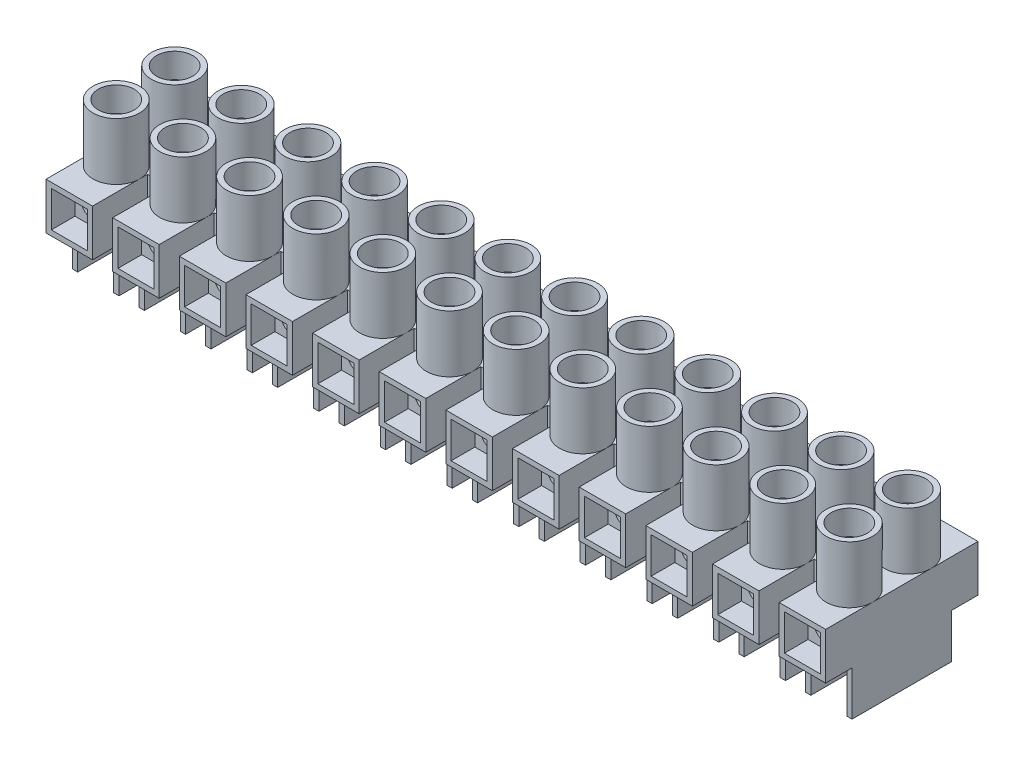
from build123d import *

# Parameters (mm, degrees)
SKETCH1_W           = 5.588
SKETCH1_H           = 5.588
BOSS_EXTRUDE1_DEPTH = 9.144
SKETCH2_R           = 2.794
BOSS_EXTRUDE2_DEPTH = 6.858
SHELL1_START        = 0.635
SHELL1_OUTLINE_R    = 2.159
SHELL1_DEPTH        = 11.811
SHELL1_2_DEPTH      = 4.318
SKETCH3_W           = 5.588
SKETCH3_H           = 5.969
BOSS_EXTRUDE3_DEPTH = 5.334
SHELL2_START        = -5.334
SHELL2_OUTLINE_W    = 4.318
SHELL2_OUTLINE_H    = 5.969
SHELL2_DEPTH        = 5.334
LPATTERN1_COUNT     = 12
LPATTERN1_PITCH     = 8.001
SKETCH5_W           = 2.413
SKETCH5_H           = 2.54
BOSS_EXTRUDE4_DEPTH = 5.588
CUT_EXTRUDE1_START  = -95.864579549
SKETCH7_R           = 1.4986
CUT_EXTRUDE1_DEPTH  = 101.452579549
LPATTERN2_COUNT     = 11
LPATTERN2_PITCH     = 8.001
LPATTERN2_2_COUNT   = 11
LPATTERN2_2_PITCH   = 8.001
SKETCH8_W           = 4.2164
SKETCH8_H           = 4.2164
SKETCH8_R           = 1.397
BOSS_EXTRUDE5_DEPTH = 6.35
LPATTERN3_COUNT     = 12
LPATTERN3_PITCH     = 8.001
SKETCH9_R           = 1.5875
BOSS_EXTRUDE6_DEPTH = 1.524
BOSS_EXTRUDE6_DRAFT = -15
SKETCH10_W          = 3.991709138
SKETCH10_H          = 0.508
CUT_EXTRUDE2_DEPTH  = 0.508
SKETCH11_R          = 1.143
BOSS_EXTRUDE7_DEPTH = 3.81
LPATTERN4_COUNT     = 12
LPATTERN4_PITCH     = 8.001
LPATTERN4_2_COUNT   = 2
LPATTERN4_2_PITCH   = 7.0104


# Read off the part's stored shape, not the designer's step: Shell1, Shell2
with BuildPart() as part:
    # Sketch1 → Boss-Extrude1 (new body)
    with BuildSketch(Plane.XY):
        with Locations((2.794, 2.794)):
            Rectangle(SKETCH1_W, SKETCH1_H)
    extrude(amount=BOSS_EXTRUDE1_DEPTH)

    # Sketch2 → Boss-Extrude2 (add)
    with BuildSketch(Plane(origin=(0, 5.588, 0), x_dir=(1, 0, 0), z_dir=(0, 1, 0))):
        with Locations(Location((2.794, -3.5052, 0), (0, 0, 180))):
            Circle(SKETCH2_R)
    extrude(amount=BOSS_EXTRUDE2_DEPTH)

    # Shell1 outline → Shell1 (cut)
    with BuildSketch(Plane(origin=(0, 0, 0), x_dir=(1, 0, 0), z_dir=(0, 1, 0)).offset(SHELL1_START)):
        with Locations((2.794, -3.5052)):
            Circle(SHELL1_OUTLINE_R)
    extrude(amount=SHELL1_DEPTH, mode=Mode.SUBTRACT)

    # Shell1 2 outline → Shell1 2 (cut)
    with BuildSketch(Plane(origin=(0, 0, 0), x_dir=(1, 0, 0), z_dir=(0, 1, 0)).offset(SHELL1_START)):
        with BuildLine():
            Line((0.635, -3.5052), (0.635, -9.144))
            Line((0.635, -9.144), (4.953, -9.144))
            Line((4.953, -9.144), (4.953, -3.5052))
            ThreePointArc((4.953, -3.5052), (2.794, -5.6642), (0.635, -3.5052))
        make_face()
        with BuildLine():
            Line((0.635, 0), (0.635, -3.5052))
            ThreePointArc((0.635, -3.5052), (2.794, -1.3462), (4.953, -3.5052))
            Line((4.953, -3.5052), (4.953, 0))
            Line((4.953, 0), (0.635, 0))
        make_face()
    extrude(amount=SHELL1_2_DEPTH, mode=Mode.SUBTRACT)

    # Sketch3 → Boss-Extrude3 (add)
    with BuildSketch(Plane.XZ):
        with Locations((2.794, 2.9845)):
            Rectangle(SKETCH3_W, SKETCH3_H)
    extrude(amount=BOSS_EXTRUDE3_DEPTH)

    # Shell2 outline → Shell2 (cut)
    with BuildSketch(Plane(origin=(0, 0, 0), x_dir=(1, 0, 0), z_dir=(0, 1, 0)).offset(SHELL2_START)):
        with Locations((2.794, -2.9845)):
            Rectangle(SHELL2_OUTLINE_W, SHELL2_OUTLINE_H)
    extrude(amount=SHELL2_DEPTH, mode=Mode.SUBTRACT)


with BuildPart() as lpattern1_1:
    # LPattern1: pattern copy
    add(part.part.moved(Location(Vector(1, 0, 0) * (1 * LPATTERN1_PITCH))))


with BuildPart() as lpattern1_2:
    # LPattern1: pattern copy
    add(part.part.moved(Location(Vector(1, 0, 0) * (2 * LPATTERN1_PITCH))))


with BuildPart() as lpattern1_3:
    # LPattern1: pattern copy
    add(part.part.moved(Location(Vector(1, 0, 0) * (3 * LPATTERN1_PITCH))))


with BuildPart() as lpattern1_4:
    # LPattern1: pattern copy
    add(part.part.moved(Location(Vector(1, 0, 0) * (4 * LPATTERN1_PITCH))))


with BuildPart() as lpattern1_5:
    # LPattern1: pattern copy
    add(part.part.moved(Location(Vector(1, 0, 0) * (5 * LPATTERN1_PITCH))))


with BuildPart() as lpattern1_6:
    # LPattern1: pattern copy
    add(part.part.moved(Location(Vector(1, 0, 0) * (6 * LPATTERN1_PITCH))))


with BuildPart() as lpattern1_7:
    # LPattern1: pattern copy
    add(part.part.moved(Location(Vector(1, 0, 0) * (7 * LPATTERN1_PITCH))))


with BuildPart() as lpattern1_8:
    # LPattern1: pattern copy
    add(part.part.moved(Location(Vector(1, 0, 0) * (8 * LPATTERN1_PITCH))))


with BuildPart() as lpattern1_9:
    # LPattern1: pattern copy
    add(part.part.moved(Location(Vector(1, 0, 0) * (9 * LPATTERN1_PITCH))))


with BuildPart() as lpattern1_10:
    # LPattern1: pattern copy
    add(part.part.moved(Location(Vector(1, 0, 0) * (10 * LPATTERN1_PITCH))))


with BuildPart() as lpattern1_11:
    # LPattern1: pattern copy
    add(part.part.moved(Location(Vector(1, 0, 0) * (11 * LPATTERN1_PITCH))))


with BuildPart() as part_1:
    add(part.part)

    add(lpattern1_1.part)  # Boss-Extrude4 merges LPattern1_1
    # Sketch5 → Boss-Extrude4 (add)
    with BuildSketch(Plane(origin=(0, 0, 0), x_dir=(1, 0, 0), z_dir=(0, 1, 0))):
        with Locations((6.7945, -1.27)):
            Rectangle(SKETCH5_W, SKETCH5_H)
    boss_extrude4 = extrude(amount=BOSS_EXTRUDE4_DEPTH)

    # Sketch7 → Cut-Extrude1 (cut)
    with BuildSketch(Plane(origin=(0, 0, 0), x_dir=(1, 0, 0), z_dir=(0, 1, 0)).offset(CUT_EXTRUDE1_START)):
        with Locations((6.7945, 0)):
            Circle(SKETCH7_R)
    cut_extrude1 = extrude(amount=CUT_EXTRUDE1_DEPTH, mode=Mode.SUBTRACT)

    add(lpattern1_2.part)  # LPattern2 merges LPattern1_2

    add(lpattern1_3.part)  # LPattern2 merges LPattern1_3

    add(lpattern1_4.part)  # LPattern2 merges LPattern1_4

    add(lpattern1_5.part)  # LPattern2 merges LPattern1_5

    add(lpattern1_6.part)  # LPattern2 merges LPattern1_6

    add(lpattern1_7.part)  # LPattern2 merges LPattern1_7

    add(lpattern1_8.part)  # LPattern2 merges LPattern1_8

    add(lpattern1_9.part)  # LPattern2 merges LPattern1_9

    add(lpattern1_10.part)  # LPattern2 merges LPattern1_10

    add(lpattern1_11.part)  # LPattern2 merges LPattern1_11
    # LPattern2: Boss-Extrude4 ×11
    with Locations(*[(i * LPATTERN2_PITCH, 0, 0) for i in range(1, LPATTERN2_COUNT)]):
        add(boss_extrude4)

    # LPattern2 2: Cut-Extrude1 ×11
    with Locations(*[(i * LPATTERN2_2_PITCH, 0, 0) for i in range(1, LPATTERN2_2_COUNT)]):
        add(cut_extrude1, mode=Mode.SUBTRACT)

    # Mirror1: part across plane


with BuildPart() as part_2:
    add(part_1.part)
    add(part_1.part.mirror(Plane.XY))


with BuildPart() as body_2:
    # Sketch8 → Boss-Extrude5 (new body)
    with BuildSketch(Plane.XY):
        with Locations((2.794, 2.794)):
            Rectangle(SKETCH8_W, SKETCH8_H)
        with Locations((2.794, 2.794)):
            Circle(SKETCH8_R, mode=Mode.SUBTRACT)
    extrude(amount=BOSS_EXTRUDE5_DEPTH)

    # Mirror2: body 2 across plane


with BuildPart() as body_2_1:
    add(body_2.part)
    add(body_2.part.mirror(Plane.XY))


with BuildPart() as lpattern3_1:
    # LPattern3: pattern copy
    add(body_2_1.part.moved(Location(Vector(1, 0, 0) * (1 * LPATTERN3_PITCH))))


with BuildPart() as lpattern3_2:
    # LPattern3: pattern copy
    add(body_2_1.part.moved(Location(Vector(1, 0, 0) * (2 * LPATTERN3_PITCH))))


with BuildPart() as lpattern3_3:
    # LPattern3: pattern copy
    add(body_2_1.part.moved(Location(Vector(1, 0, 0) * (3 * LPATTERN3_PITCH))))


with BuildPart() as lpattern3_4:
    # LPattern3: pattern copy
    add(body_2_1.part.moved(Location(Vector(1, 0, 0) * (4 * LPATTERN3_PITCH))))


with BuildPart() as lpattern3_5:
    # LPattern3: pattern copy
    add(body_2_1.part.moved(Location(Vector(1, 0, 0) * (5 * LPATTERN3_PITCH))))


with BuildPart() as lpattern3_6:
    # LPattern3: pattern copy
    add(body_2_1.part.moved(Location(Vector(1, 0, 0) * (6 * LPATTERN3_PITCH))))


with BuildPart() as lpattern3_7:
    # LPattern3: pattern copy
    add(body_2_1.part.moved(Location(Vector(1, 0, 0) * (7 * LPATTERN3_PITCH))))


with BuildPart() as lpattern3_8:
    # LPattern3: pattern copy
    add(body_2_1.part.moved(Location(Vector(1, 0, 0) * (8 * LPATTERN3_PITCH))))


with BuildPart() as lpattern3_9:
    # LPattern3: pattern copy
    add(body_2_1.part.moved(Location(Vector(1, 0, 0) * (9 * LPATTERN3_PITCH))))


with BuildPart() as lpattern3_10:
    # LPattern3: pattern copy
    add(body_2_1.part.moved(Location(Vector(1, 0, 0) * (10 * LPATTERN3_PITCH))))


with BuildPart() as lpattern3_11:
    # LPattern3: pattern copy
    add(body_2_1.part.moved(Location(Vector(1, 0, 0) * (11 * LPATTERN3_PITCH))))


with BuildPart() as body_14:
    # Sketch9 → Boss-Extrude6 (with draft: the straight prism first)
    with BuildSketch(Plane(origin=(0, 8.0772, 0), x_dir=(1, 0, 0), z_dir=(0, 1, 0))):
        with Locations((2.794, -3.5052)):
            Circle(SKETCH9_R)
    extrude(amount=BOSS_EXTRUDE6_DEPTH)
    # Boss-Extrude6: the draft: its side faces are tilted about the plane it starts from
    boss_extrude6_sides = [body_14.faces().sort_by_distance(p)[0] for p in [
        (1.2065, 8.8392, 3.5052),
    ]]
    draft(boss_extrude6_sides, Plane(origin=(0, 8.0772, 0), x_dir=(1, 0, 0), z_dir=(0, 1, 0)), BOSS_EXTRUDE6_DRAFT)

    # Sketch10 → Cut-Extrude2 (cut)
    with BuildSketch(Plane(origin=(0, 9.6012, 0), x_dir=(1, 0, 0), z_dir=(0, 1, 0))):
        with Locations((2.794, -3.5052)):
            Rectangle(SKETCH10_W, SKETCH10_H)
    extrude(amount=-CUT_EXTRUDE2_DEPTH, mode=Mode.SUBTRACT)

    # Sketch11 → Boss-Extrude7 (add)
    with BuildSketch(Plane.XZ.offset(-8.0772)):
        with Locations(Location((2.794, 3.5052, 0), (0, 0, 90))):
            Circle(SKETCH11_R)
    extrude(amount=BOSS_EXTRUDE7_DEPTH)


with BuildPart() as lpattern4_1:
    # LPattern4: pattern copy
    add(body_14.part.moved(Location(Vector(1, 0, 0) * (1 * LPATTERN4_PITCH))))


with BuildPart() as lpattern4_2:
    # LPattern4: pattern copy
    add(body_14.part.moved(Location(Vector(1, 0, 0) * (2 * LPATTERN4_PITCH))))


with BuildPart() as lpattern4_3:
    # LPattern4: pattern copy
    add(body_14.part.moved(Location(Vector(1, 0, 0) * (3 * LPATTERN4_PITCH))))


with BuildPart() as lpattern4_4:
    # LPattern4: pattern copy
    add(body_14.part.moved(Location(Vector(1, 0, 0) * (4 * LPATTERN4_PITCH))))


with BuildPart() as lpattern4_5:
    # LPattern4: pattern copy
    add(body_14.part.moved(Location(Vector(1, 0, 0) * (5 * LPATTERN4_PITCH))))


with BuildPart() as lpattern4_6:
    # LPattern4: pattern copy
    add(body_14.part.moved(Location(Vector(1, 0, 0) * (6 * LPATTERN4_PITCH))))


with BuildPart() as lpattern4_7:
    # LPattern4: pattern copy
    add(body_14.part.moved(Location(Vector(1, 0, 0) * (7 * LPATTERN4_PITCH))))


with BuildPart() as lpattern4_8:
    # LPattern4: pattern copy
    add(body_14.part.moved(Location(Vector(1, 0, 0) * (8 * LPATTERN4_PITCH))))


with BuildPart() as lpattern4_9:
    # LPattern4: pattern copy
    add(body_14.part.moved(Location(Vector(1, 0, 0) * (9 * LPATTERN4_PITCH))))


with BuildPart() as lpattern4_10:
    # LPattern4: pattern copy
    add(body_14.part.moved(Location(Vector(1, 0, 0) * (10 * LPATTERN4_PITCH))))


with BuildPart() as lpattern4_11:
    # LPattern4: pattern copy
    add(body_14.part.moved(Location(Vector(1, 0, 0) * (11 * LPATTERN4_PITCH))))


with BuildPart() as lpattern4_2_1:
    # LPattern4 2: pattern copy
    add(body_14.part.moved(Location(Vector(0, 0, -1) * (1 * LPATTERN4_2_PITCH))))


with BuildPart() as lpattern4_2_2:
    # LPattern4 2: pattern copy
    add(lpattern4_1.part.moved(Location(Vector(0, 0, -1) * (1 * LPATTERN4_2_PITCH))))


with BuildPart() as lpattern4_2_3:
    # LPattern4 2: pattern copy
    add(lpattern4_2.part.moved(Location(Vector(0, 0, -1) * (1 * LPATTERN4_2_PITCH))))


with BuildPart() as lpattern4_2_4:
    # LPattern4 2: pattern copy
    add(lpattern4_3.part.moved(Location(Vector(0, 0, -1) * (1 * LPATTERN4_2_PITCH))))


with BuildPart() as lpattern4_2_5:
    # LPattern4 2: pattern copy
    add(lpattern4_4.part.moved(Location(Vector(0, 0, -1) * (1 * LPATTERN4_2_PITCH))))


with BuildPart() as lpattern4_2_6:
    # LPattern4 2: pattern copy
    add(lpattern4_5.part.moved(Location(Vector(0, 0, -1) * (1 * LPATTERN4_2_PITCH))))


with BuildPart() as lpattern4_2_7:
    # LPattern4 2: pattern copy
    add(lpattern4_6.part.moved(Location(Vector(0, 0, -1) * (1 * LPATTERN4_2_PITCH))))


with BuildPart() as lpattern4_2_8:
    # LPattern4 2: pattern copy
    add(lpattern4_7.part.moved(Location(Vector(0, 0, -1) * (1 * LPATTERN4_2_PITCH))))


with BuildPart() as lpattern4_2_9:
    # LPattern4 2: pattern copy
    add(lpattern4_8.part.moved(Location(Vector(0, 0, -1) * (1 * LPATTERN4_2_PITCH))))


with BuildPart() as lpattern4_2_10:
    # LPattern4 2: pattern copy
    add(lpattern4_9.part.moved(Location(Vector(0, 0, -1) * (1 * LPATTERN4_2_PITCH))))


with BuildPart() as lpattern4_2_11:
    # LPattern4 2: pattern copy
    add(lpattern4_10.part.moved(Location(Vector(0, 0, -1) * (1 * LPATTERN4_2_PITCH))))


with BuildPart() as lpattern4_2_12:
    # LPattern4 2: pattern copy
    add(lpattern4_11.part.moved(Location(Vector(0, 0, -1) * (1 * LPATTERN4_2_PITCH))))


solid = Compound([part_2.part, body_2_1.part, lpattern3_1.part, lpattern3_2.part, lpattern3_3.part, lpattern3_4.part, lpattern3_5.part, lpattern3_6.part, lpattern3_7.part, lpattern3_8.part, lpattern3_9.part, lpattern3_10.part, lpattern3_11.part, body_14.part, lpattern4_1.part, lpattern4_2.part, lpattern4_3.part, lpattern4_4.part, lpattern4_5.part, lpattern4_6.part, lpattern4_7.part, lpattern4_8.part, lpattern4_9.part, lpattern4_10.part, lpattern4_11.part, lpattern4_2_1.part, lpattern4_2_2.part, lpattern4_2_3.part, lpattern4_2_4.part, lpattern4_2_5.part, lpattern4_2_6.part, lpattern4_2_7.part, lpattern4_2_8.part, lpattern4_2_9.part, lpattern4_2_10.part, lpattern4_2_11.part, lpattern4_2_12.part])
